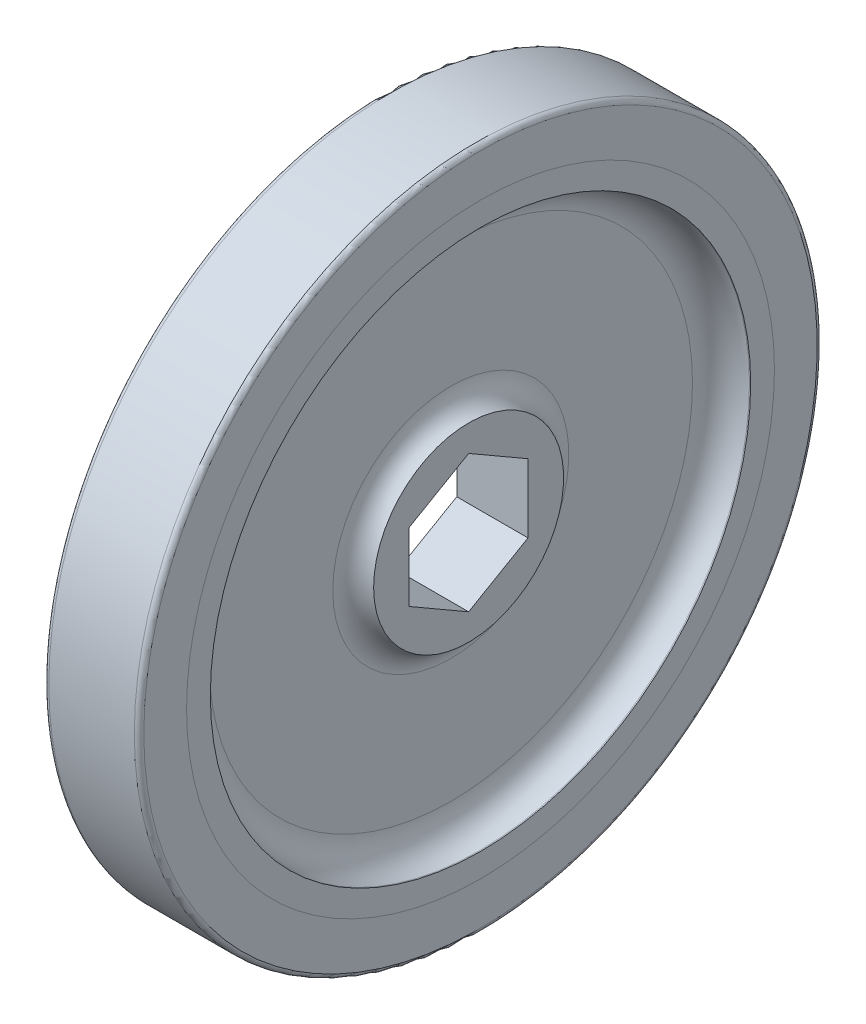
from build123d import *

# Parameters (mm, degrees)
CONG_1_R            = 2.54
CONG_2_R            = 3.048
HEX_HOLE_DEPTH      = 49.312192172
HEX_HOLE_DEPTH_BACK = 49.312192172
CONG_3_R            = 0.508


with BuildPart() as part:
    # Esquisse1 → Révolution1 (revolve)
    with BuildSketch(Plane.XY, mode=Mode.PRIVATE) as r_volution1_sk:
        Polygon((1.905, 10.16), (3.81, 10.16), (3.81, 0), (-3.81, 0), (-3.81, 10.16), (-1.905, 10.16), (-1.905, 28.8925), (-5.08, 28.8925), (-5.08, 31.4325), (-2.54, 31.4325), (-2.54, 33.9725), (2.54, 33.9725), (2.54, 31.4325), (5.08, 31.4325), (5.08, 28.8925), (1.905, 28.8925), align=None)
    revolve(r_volution1_sk.sketch.rotate(Axis((-3.81, 0, 0), (1, 0, 0)), 90), axis=Axis((-3.81, 0, 0), (1, 0, 0)))

    # Congé1
    # the kernel refuses this fillet: 2.54 mm, written as the material it adds along each edge
    with BuildSketch(Plane(origin=(-1.905, 0, 0), x_dir=(0, 0, 1), z_dir=(0, 1, 0))) as cong_1_piece_1:
        with BuildLine():
            CenterArc((12.619344425, -2.54), CONG_1_R, 90, 75.522487814)
            Line((12.619344425, 0), (12.619344425, 0.0508))
            Line((12.619344425, 0.0508), (10.16, 0.0508))
            Line((10.16, 0.0508), (10.1092, 0))
            ThreePointArc((10.1092, 0), (10.1092, -0.9525), (10.110813112, -1.8923))
            Line((10.110813112, -1.8923), (10.16, -1.905))
        make_face()
    revolve(axis=Axis((-1.905, 0, 0), (1, 0, 0)))
    with BuildSketch(Plane(origin=(1.905, 0, 0), x_dir=(0, 0, 1), z_dir=(0, 1, 0))) as cong_1_piece_2:
        with BuildLine():
            CenterArc((12.619344425, 2.54), CONG_1_R, 194.477512186, 75.522487814)
            Line((12.619344425, 0), (12.619344425, -0.0508))
            Line((12.619344425, -0.0508), (10.16, -0.0508))
            Line((10.16, -0.0508), (10.1092, 0))
            ThreePointArc((10.1092, 0), (10.1092, 0.9525), (10.110813112, 1.8923))
            Line((10.110813112, 1.8923), (10.16, 1.905))
        make_face()
    revolve(axis=Axis((1.905, 0, 0), (1, 0, 0)))

    # Congé2
    cong_2_edges = [part.edges().sort_by_distance(p)[0] for p in [
        (-1.905, 0, -28.8925),
        (1.905, 0, -28.8925),
    ]]
    fillet(cong_2_edges, radius=CONG_2_R)

    # Esquisse3 → hex_hole (cut, two sides: drawn at the far end of the back side and taken through both)
    with BuildSketch(Plane(origin=(0, 0, 0), x_dir=(0, 0, -1), z_dir=(1, 0, 0)).offset(-HEX_HOLE_DEPTH_BACK)):
        Polygon((0, 7.332348419), (-6.35, 3.666174209), (-6.35, -3.666174209), (0, -7.332348419), (6.35, -3.666174209), (6.35, 3.666174209), align=None)
    extrude(amount=HEX_HOLE_DEPTH + HEX_HOLE_DEPTH_BACK, mode=Mode.SUBTRACT)


with BuildPart() as body_2:
    # Esquisse2 → Révolution2 (revolve)
    with BuildSketch(Plane.XY, mode=Mode.PRIVATE) as r_volution2_sk:
        Polygon((-5.08, 31.4325), (-2.54, 31.4325), (-2.54, 33.9725), (2.54, 33.9725), (2.54, 31.4325), (5.08, 31.4325), (5.08, 36.5125), (-5.08, 36.5125), align=None)
    revolve(r_volution2_sk.sketch.rotate(Axis((-3.81, 0, 0), (1, 0, 0)), 270), axis=Axis((-3.81, 0, 0), (1, 0, 0)))

    # Congé3
    cong_3_edges = [body_2.edges().sort_by_distance(p)[0] for p in [
        (-5.08, 0, 36.5125),
        (5.08, 0, 36.5125),
    ]]
    fillet(cong_3_edges, radius=CONG_3_R)


solid = Compound([part.part, body_2.part])
